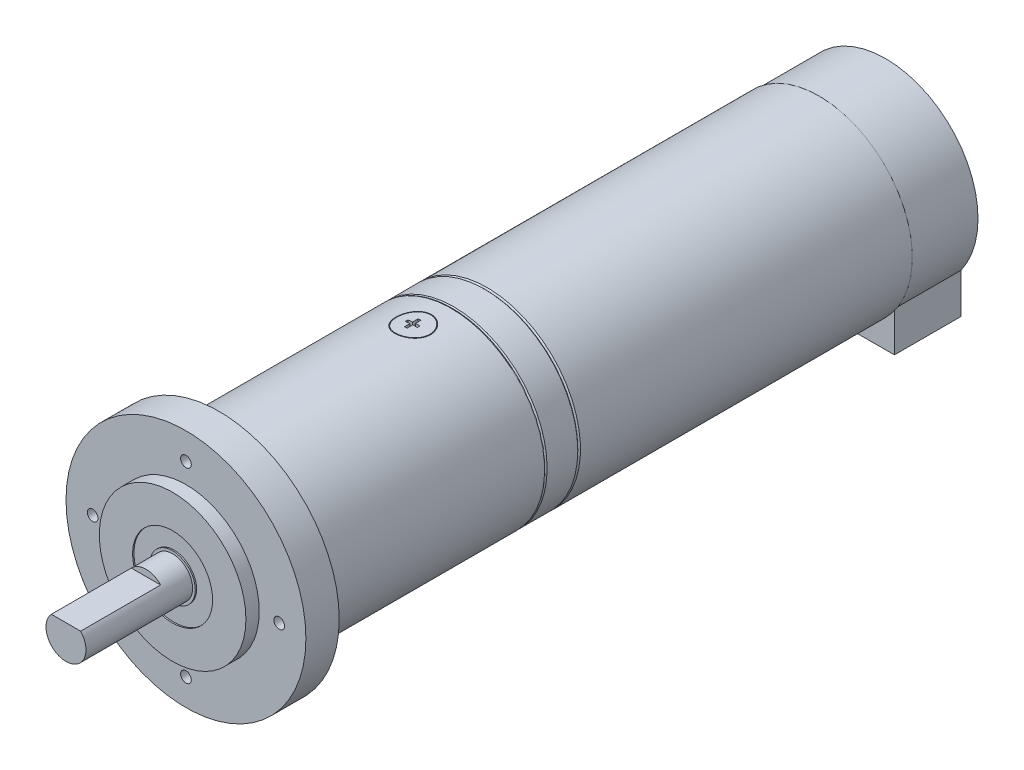
from build123d import *

# Parameters (mm, degrees)
SKETCH1_R                   = 18
BOSS_EXTRUDE2_DEPTH         = 5
SKETCH1_4_R                 = 11
BOSS_EXTRUDE3_DEPTH         = 2
SKETCH2_R                   = 3
BOSS_EXTRUDE4_DEPTH         = 16
SKETCH3_W                   = 6.362998302
SKETCH3_H                   = 1.749824533
CUT_EXTRUDE1_DEPTH          = 12
SKETCH4_R                   = 6
SKETCH4_R_2                 = 3.4
CUT_EXTRUDE2_DEPTH          = 0.2
TAP_DRILL_FOR_M2X0_4_TAP1_D = 1.6
SKETCH5_R                   = 14
BOSS_EXTRUDE5_DEPTH         = 35
FILLET2_R                   = 0.2
SKETCH7_R                   = 14
BOSS_EXTRUDE6_DEPTH         = 5
CHAMFER1_SIZE               = 0.2
SKETCH10_R                  = 14
BOSS_EXTRUDE7_DEPTH         = 50
CHAMFER2_SIZE               = 0.2
BOSS_EXTRUDE8_DEPTH         = 10
SKETCH12_R                  = 2.6
SKETCH12_R_2                = 2.5
CUT_EXTRUDE3_DEPTH          = 10.13
CUT_EXTRUDE4_DEPTH          = 2


# Some blends are built 0.0001 mm under size
with BuildPart() as part:
    # Sketch1 → Boss-Extrude2 (new body)
    with BuildSketch(Plane.XY):
        Circle(SKETCH1_R)
    extrude(amount=-BOSS_EXTRUDE2_DEPTH)

    # Sketch1<4> → Boss-Extrude3 (add)
    with BuildSketch(Plane.XY):
        Circle(SKETCH1_4_R)
    extrude(amount=BOSS_EXTRUDE3_DEPTH)

    # Sketch2 → Boss-Extrude4 (add)
    with BuildSketch(Plane.XY.offset(2)):
        Circle(SKETCH2_R)
    extrude(amount=BOSS_EXTRUDE4_DEPTH)

    # Sketch3 → Cut-Extrude1 (cut)
    with BuildSketch(Plane.XY.offset(18)):
        with Locations((0.265444357, 2.918366652)):
            Rectangle(SKETCH3_W, SKETCH3_H)
    extrude(amount=-CUT_EXTRUDE1_DEPTH, mode=Mode.SUBTRACT)

    # Sketch4 → Cut-Extrude2 (cut)
    with BuildSketch(Plane.XY.offset(2)):
        Circle(SKETCH4_R)
        Circle(SKETCH4_R_2, mode=Mode.SUBTRACT)
    extrude(amount=-CUT_EXTRUDE2_DEPTH, mode=Mode.SUBTRACT)

    # Tap Drill for M2x0.4 Tap1 (through all)
    with Locations(Plane(origin=(0, 14, -5), x_dir=(-1, 0, 0), z_dir=(0, 0, -1))):
        with Locations((0, 0), (-14, -14), (0, -28), (14, -14)):
            Hole(TAP_DRILL_FOR_M2X0_4_TAP1_D / 2)

    # Sketch5 → Boss-Extrude5 (add)
    with BuildSketch(Plane(origin=(0, 0, -5), x_dir=(-1, 0, 0), z_dir=(0, 0, -1))):
        with Locations(Location((0, 0, 0), (0, 0, 176.725509844))):
            Circle(SKETCH5_R)
    extrude(amount=BOSS_EXTRUDE5_DEPTH)

    # Fillet2
    fillet2_edges = [part.edges().sort_by_distance(p)[0] for p in [
        (-13.977142857, -0.799673403, -40),
    ]]
    fillet(fillet2_edges, radius=FILLET2_R)

    # Sketch7 → Boss-Extrude6 (add)
    with BuildSketch(Plane(origin=(0, 0, -40), x_dir=(-1, 0, 0), z_dir=(0, 0, -1))):
        with Locations(Location((0, 0, 0), (0, 0, 176.725509844))):
            Circle(SKETCH7_R)
    extrude(amount=BOSS_EXTRUDE6_DEPTH)

    # Chamfer1
    chamfer1_edges = [part.edges().sort_by_distance(p)[0] for p in [
        (-13.977142857, -0.799673403, -40),
        (-13.977142857, -0.799673403, -45),
    ]]
    chamfer(chamfer1_edges, length=CHAMFER1_SIZE - 0.0001)  # a hair under: the kernel refuses the full size

    # Sketch10 → Boss-Extrude7 (add)
    with BuildSketch(Plane(origin=(0, 0, -45), x_dir=(-1, 0, 0), z_dir=(0, 0, -1))):
        with Locations(Location((0, 0, 0), (0, 0, 176.725509844))):
            Circle(SKETCH10_R)
    extrude(amount=BOSS_EXTRUDE7_DEPTH)

    # Chamfer2
    # the kernel refuses this chamfer: 0.2 mm, written as the material it takes off along each edge
    with BuildSketch(Plane(origin=(0, 0, -45), x_dir=(0.9983673469383324, 0.057119528773576726, 0), z_dir=(-0.057119528773576726, 0.9983673469383324, 0))) as chamfer2_piece_1:
        Polygon((14, CHAMFER2_SIZE), (14 - CHAMFER2_SIZE, 0), (14, 0), align=None)
    revolve(axis=Axis((0, 0, -45), (0, 0, -1)), mode=Mode.SUBTRACT)

    # Sketch12 → Cut-Extrude3 (cut)
    with BuildSketch(Plane(origin=(0, 14, 0), x_dir=(1, 0, 0), z_dir=(0, 1, 0))):
        with Locations(Location((-0.830324238, 34.935733276, 0), (0, 0, 270))):
            Circle(SKETCH12_R)
        with Locations(Location((-0.830324238, 34.935733276, 0), (0, 0, 270))):
            Circle(SKETCH12_R_2, mode=Mode.SUBTRACT)
    extrude(amount=-CUT_EXTRUDE3_DEPTH, mode=Mode.SUBTRACT)

    # Sketch13 → Cut-Extrude4 (cut)
    with BuildSketch(Plane(origin=(0, 14, 0), x_dir=(1, 0, 0), z_dir=(0, 1, 0))):
        Polygon((-0.743156629, 35.174011268), (-0.037154138, 35.174011268), (-0.037154138, 34.777385043), (-0.743156629, 34.777385043), (-0.743156629, 33.944764058), (-1.157734464, 33.944764058), (-1.157734464, 34.777385043), (-1.858828415, 34.777385043), (-1.858828415, 35.174011268), (-1.157734464, 35.174011268), (-1.157734464, 35.994600549), (-0.743156629, 35.994600549), align=None)
    extrude(amount=-CUT_EXTRUDE4_DEPTH, mode=Mode.SUBTRACT)


with BuildPart() as body_2:
    # Sketch11 → Boss-Extrude8 (new body)
    with BuildSketch(Plane(origin=(0, 0, -95), x_dir=(-1, 0, 0), z_dir=(0, 0, -1))):
        with BuildLine():
            Line((-11.313708499, -8), (-11.313708499, -14))
            Line((-11.313708499, -14), (11.313708499, -14))
            Line((11.313708499, -14), (11.313708499, -8))
            ThreePointArc((11.313708499, -8), (0, 13.856406461), (-11.313708499, -8))
        make_face()
    extrude(amount=BOSS_EXTRUDE8_DEPTH)


solid = Compound([part.part, body_2.part])
